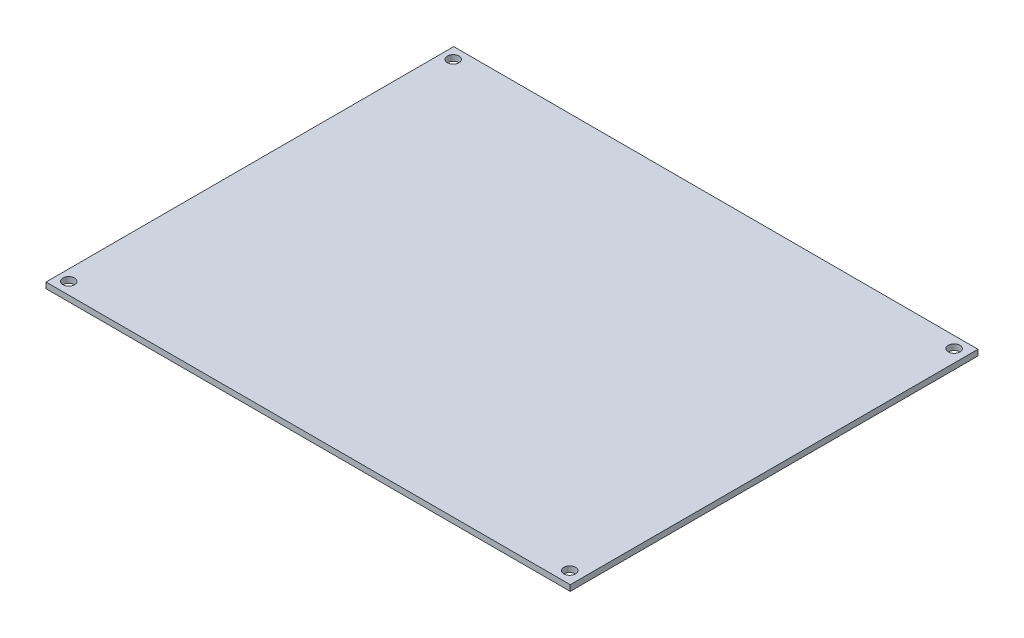
from build123d import *

# Parameters (mm, degrees)
SKETCH1_W           = 90
SKETCH1_H           = 70
BOSS_EXTRUDE1_DEPTH = 1
SKETCH2_R           = 1
CUT_EXTRUDE1_DEPTH  = 10


with BuildPart() as part:
    # Sketch1 → Boss-Extrude1 (new body)
    with BuildSketch(Plane(origin=(0, 0, 0), x_dir=(1, 0, 0), z_dir=(0, 1, 0))):
        with Locations((45, 35)):
            Rectangle(SKETCH1_W, SKETCH1_H)
    extrude(amount=BOSS_EXTRUDE1_DEPTH)

    # Sketch2 → Cut-Extrude1 (cut)
    with BuildSketch(Plane(origin=(0, 1, 0), x_dir=(1, 0, 0), z_dir=(0, 1, 0))):
        with Locations((87.852246582, 68.05)):
            Circle(SKETCH2_R)
        with Locations((87.852246582, 2.05)):
            Circle(SKETCH2_R)
        with Locations((1.852246582, 2.05)):
            Circle(SKETCH2_R)
        with Locations((1.852246582, 68.05)):
            Circle(SKETCH2_R)
    extrude(amount=-CUT_EXTRUDE1_DEPTH, mode=Mode.SUBTRACT)


solid = part.part
